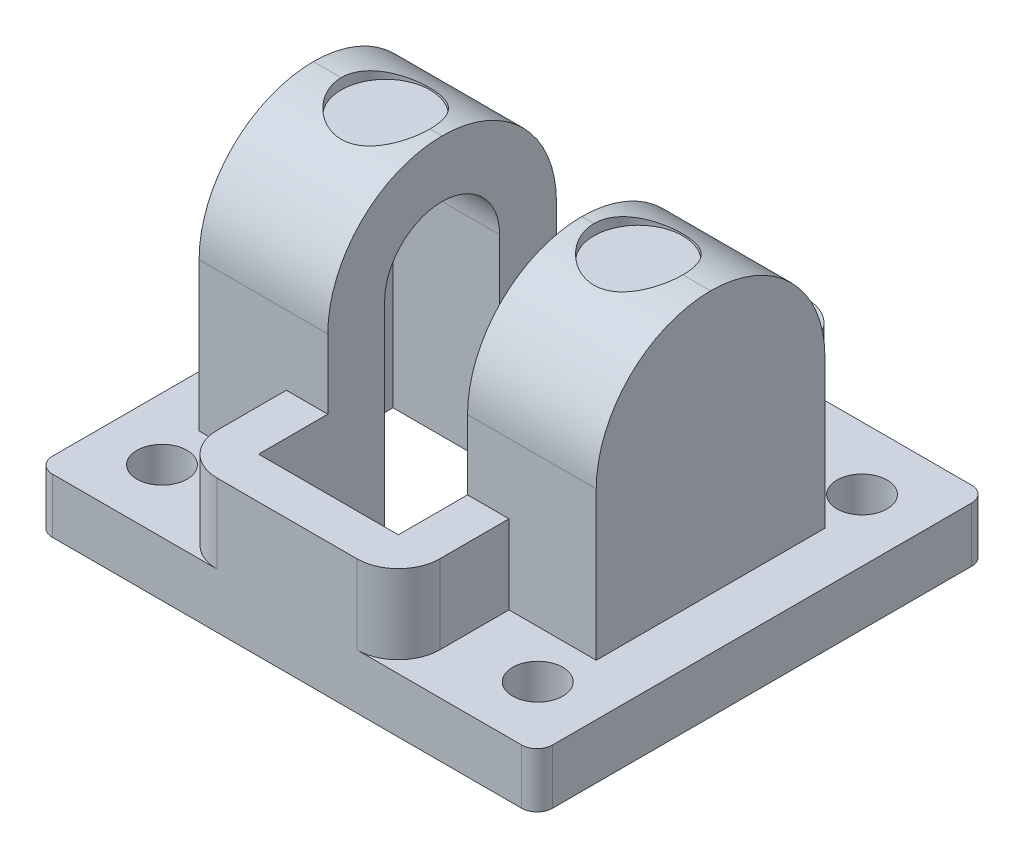
from build123d import *

# Parameters (mm, degrees)
SKETCH2_W           = 18.9992
SKETCH2_H           = 17.0942
SKETCH2_R           = 0.9525
BOSS_EXTRUDE1_DEPTH = 2.0828
BOSS_EXTRUDE2_START = 2.0828
SKETCH2_3_W         = 1.5748
SKETCH2_3_H         = 8.6868
SKETCH2_3_W_2       = 5.3086
SKETCH2_3_H_2       = 2.6289
BOSS_EXTRUDE2_DEPTH = 2.9972
BOSS_EXTRUDE3_START = 2.0828
SKETCH2_4_W         = 3.3147
SKETCH2_4_H         = 8.6868
BOSS_EXTRUDE3_DEPTH = 9.9822
BOSS_EXTRUDE4_START = 2.0828
SKETCH2_6_W         = 1.5748
SKETCH2_6_H         = 8.6868
BOSS_EXTRUDE4_DEPTH = 9.9822
CUT_EXTRUDE1_REACH  = 19.574
SKETCH2_5_W         = 5.3086
SKETCH2_5_H         = 2.6289
SKETCH2_5_H_2       = 8.6868
SKETCH4_W           = 13.4112
SKETCH4_H           = 4.3688
CUT_EXTRUDE2_DEPTH  = 9.906
FILLET1_R           = 2.1844
FILLET2_R           = 4.3434
FILLET3_R           = 1.5748
FILLET4_R           = 0.5842
SKETCH6_R           = 1.6891
CUT_EXTRUDE3_DEPTH  = 0.4064


with BuildPart() as part:
    # Sketch2 → Boss-Extrude1 (new body)
    with BuildSketch(Plane(origin=(0, 0, 0), x_dir=(1, 0, 0), z_dir=(0, 1, 0))):
        Rectangle(SKETCH2_W, SKETCH2_H)
        with Locations(Location((-7.1374, -6.1595, 0), (0, 0, 270))):
            Circle(SKETCH2_R, mode=Mode.SUBTRACT)
        with Locations(Location((-7.1374, 6.1595, 0), (0, 0, 270))):
            Circle(SKETCH2_R, mode=Mode.SUBTRACT)
        with Locations(Location((7.1374, 6.1595, 0), (0, 0, 270))):
            Circle(SKETCH2_R, mode=Mode.SUBTRACT)
        with Locations(Location((7.1374, -6.1595, 0), (0, 0, 270))):
            Circle(SKETCH2_R, mode=Mode.SUBTRACT)
    extrude(amount=BOSS_EXTRUDE1_DEPTH)

    # Sketch2<3> → Boss-Extrude2 (add)
    with BuildSketch(Plane(origin=(0, 0, 0), x_dir=(1, 0, 0), z_dir=(0, 1, 0)).offset(BOSS_EXTRUDE2_START)):
        Polygon((4.2291, 8.5471), (-4.2291, 8.5471), (-4.2291, 4.3434), (-2.6543, 4.3434), (-2.6543, 6.9723), (2.6543, 6.9723), (2.6543, 4.3434), (4.2291, 4.3434), align=None)
        with Locations((-3.4417, 0)):
            Rectangle(SKETCH2_3_W, SKETCH2_3_H)
        with Locations((3.4417, 0)):
            Rectangle(SKETCH2_3_W, SKETCH2_3_H)
        Polygon((-4.2291, -4.3434), (-4.2291, -8.5471), (4.2291, -8.5471), (4.2291, -4.3434), (2.6543, -4.3434), (2.6543, -6.9723), (-2.6543, -6.9723), (-2.6543, -4.3434), align=None)
        with Locations((0, 5.65785)):
            Rectangle(SKETCH2_3_W_2, SKETCH2_3_H_2)
        Rectangle(SKETCH2_3_W_2, SKETCH2_3_H)
        with Locations((0, -5.65785)):
            Rectangle(SKETCH2_3_W_2, SKETCH2_3_H_2)
    extrude(amount=BOSS_EXTRUDE2_DEPTH)

    # Sketch2<4> → Boss-Extrude3 (add)
    with BuildSketch(Plane(origin=(0, 0, 0), x_dir=(1, 0, 0), z_dir=(0, 1, 0)).offset(BOSS_EXTRUDE3_START)):
        with Locations((5.88645, 0)):
            Rectangle(SKETCH2_4_W, SKETCH2_4_H)
        with Locations((-5.88645, 0)):
            Rectangle(SKETCH2_4_W, SKETCH2_4_H)
    extrude(amount=BOSS_EXTRUDE3_DEPTH)

    # Sketch2<6> → Boss-Extrude4 (add)
    with BuildSketch(Plane(origin=(0, 0, 0), x_dir=(1, 0, 0), z_dir=(0, 1, 0)).offset(BOSS_EXTRUDE4_START)):
        with Locations((-3.4417, 0)):
            Rectangle(SKETCH2_6_W, SKETCH2_6_H)
        with Locations((3.4417, 0)):
            Rectangle(SKETCH2_6_W, SKETCH2_6_H)
    extrude(amount=BOSS_EXTRUDE4_DEPTH)

    # Sketch2<5> → Cut-Extrude1 (cut, up to next)
    with BuildSketch(Plane(origin=(0, 0, 0), x_dir=(1, 0, 0), z_dir=(0, 1, 0)), mode=Mode.PRIVATE) as cut_extrude1_sk1:
        with Locations((0, 5.65785)):
            Rectangle(SKETCH2_5_W, SKETCH2_5_H)
    cut_extrude1_tool1 = extrude(cut_extrude1_sk1.sketch, amount=CUT_EXTRUDE1_REACH, mode=Mode.PRIVATE) & part.part
    # Sketch2<5> → Cut-Extrude1 (cut, up to next)
    with BuildSketch(Plane(origin=(0, 0, 0), x_dir=(1, 0, 0), z_dir=(0, 1, 0)), mode=Mode.PRIVATE) as cut_extrude1_sk2:
        Rectangle(SKETCH2_5_W, SKETCH2_5_H_2)
    cut_extrude1_tool2 = extrude(cut_extrude1_sk2.sketch, amount=CUT_EXTRUDE1_REACH, mode=Mode.PRIVATE) & part.part
    # Sketch2<5> → Cut-Extrude1 (cut, up to next)
    with BuildSketch(Plane(origin=(0, 0, 0), x_dir=(1, 0, 0), z_dir=(0, 1, 0)), mode=Mode.PRIVATE) as cut_extrude1_sk3:
        with Locations((0, -5.65785)):
            Rectangle(SKETCH2_5_W, SKETCH2_5_H)
    cut_extrude1_tool3 = extrude(cut_extrude1_sk3.sketch, amount=CUT_EXTRUDE1_REACH, mode=Mode.PRIVATE) & part.part
    add(cut_extrude1_tool1.solids().sort_by_distance((0, 0, -5.65785))[0], mode=Mode.SUBTRACT)
    add(cut_extrude1_tool2.solids().sort_by_distance((0, 0, 0))[0], mode=Mode.SUBTRACT)
    add(cut_extrude1_tool3.solids().sort_by_distance((0, 0, 5.65785))[0], mode=Mode.SUBTRACT)

    # Sketch4 → Cut-Extrude2 (cut)
    with BuildSketch(Plane(origin=(0, 0, 0), x_dir=(1, 0, 0), z_dir=(0, 1, 0))):
        Rectangle(SKETCH4_W, SKETCH4_H)
    extrude(amount=CUT_EXTRUDE2_DEPTH, mode=Mode.SUBTRACT)

    # Fillet1
    fillet1_edges = [part.edges().sort_by_distance(p)[0] for p in [
        (4.67995, 9.906, -2.1844),
        (4.67995, 9.906, 2.1844),
        (-4.67995, 9.906, 2.1844),
        (-4.67995, 9.906, -2.1844),
    ]]
    fillet(fillet1_edges, radius=FILLET1_R - 0.0001)  # a hair under: the kernel refuses the full size

    # Fillet2
    fillet2_edges = [part.edges().sort_by_distance(p)[0] for p in [
        (-5.09905, 12.065, 4.3434),
        (-5.09905, 12.065, -4.3434),
        (5.09905, 12.065, 4.3434),
        (5.09905, 12.065, -4.3434),
    ]]
    fillet(fillet2_edges, radius=FILLET2_R - 0.0001)  # a hair under: the kernel refuses the full size

    # Fillet3
    fillet3_edges = [part.edges().sort_by_distance(p)[0] for p in [
        (4.2291, 3.5814, 8.5471),
        (4.2291, 3.5814, -8.5471),
        (-4.2291, 3.5814, -8.5471),
        (-4.2291, 3.5814, 8.5471),
    ]]
    fillet(fillet3_edges, radius=FILLET3_R)

    # Fillet4
    fillet4_edges = [part.edges().sort_by_distance(p)[0] for p in [
        (9.4996, 1.0414, 8.5471),
        (-9.4996, 1.0414, 8.5471),
        (-9.4996, 1.0414, -8.5471),
        (9.4996, 1.0414, -8.5471),
    ]]
    fillet(fillet4_edges, radius=FILLET4_R)

    # Sketch6 → Cut-Extrude3 (cut)
    with BuildSketch(Plane(origin=(0, 12.065, 0), x_dir=(1, 0, 0), z_dir=(0, 1, 0))):
        with Locations(Location((4.8006, 0, 0), (0, 0, 270))):
            Circle(SKETCH6_R)
        with Locations(Location((-4.8006, 0, 0), (0, 0, 270))):
            Circle(SKETCH6_R)
    extrude(amount=-CUT_EXTRUDE3_DEPTH, mode=Mode.SUBTRACT)


solid = part.part
